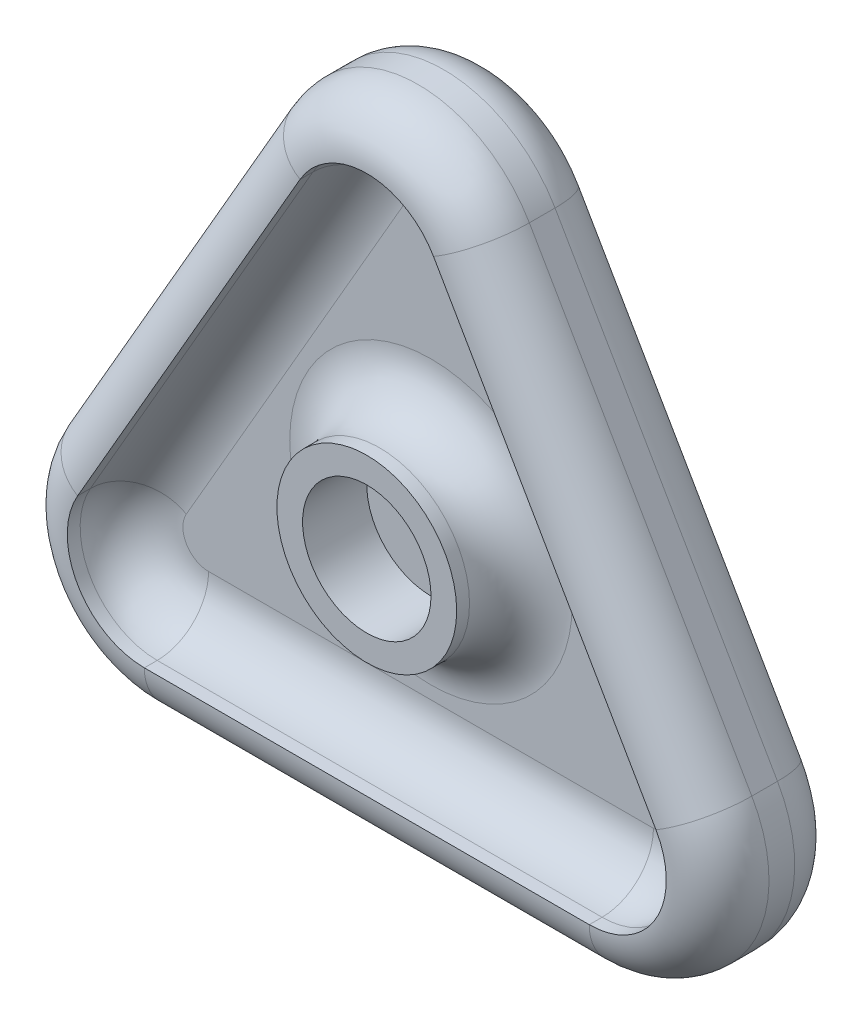
from build123d import *

# Parameters (mm, degrees)
EXTRUDE_1_DEPTH     = 5
CUT_EXTRUDE_1_DEPTH = 2.5
SKETCH_4_R          = 3.5
SKETCH_4_R_2        = 2.5
EXTRUDE_2_DEPTH     = 2.5
FILLET_1_R          = 2
FILLET_2_R          = 2
FILLET_3_R          = 2
SCALE_1_SCALE       = 2


with BuildPart() as part:
    # 草图2 → 凸台-拉伸1 (new body)
    with BuildSketch(Plane.XY):
        with BuildLine():
            Line((12.990381057, -2.5), (4.330127019, 12.5))
            ThreePointArc((4.330127019, 12.5), (0, 15), (-4.330127019, 12.5))
            Line((-4.330127019, 12.5), (-12.990381057, -2.5))
            ThreePointArc((-12.990381057, -2.5), (-12.990381057, -7.5), (-8.660254038, -10))
            Line((-8.660254038, -10), (8.660254038, -10))
            ThreePointArc((8.660254038, -10), (12.990381057, -7.5), (12.990381057, -2.5))
        make_face()
    extrude(amount=EXTRUDE_1_DEPTH)

    # 草图3 → 切除-拉伸1 (cut)
    with BuildSketch(Plane.XY.offset(5)):
        with BuildLine():
            Line((11.258330249, -3.5), (2.598076211, 11.5))
            ThreePointArc((2.598076211, 11.5), (0, 13), (-2.598076211, 11.5))
            Line((-2.598076211, 11.5), (-11.258330249, -3.5))
            ThreePointArc((-11.258330249, -3.5), (-11.258330249, -6.5), (-8.660254038, -8))
            Line((-8.660254038, -8), (8.660254038, -8))
            ThreePointArc((8.660254038, -8), (11.258330249, -6.5), (11.258330249, -3.5))
        make_face()
    extrude(amount=-CUT_EXTRUDE_1_DEPTH, mode=Mode.SUBTRACT)

    # 草图4 → 凸台-拉伸2 (add)
    with BuildSketch(Plane.XY.offset(2.5)):
        Circle(SKETCH_4_R)
        Circle(SKETCH_4_R_2, mode=Mode.SUBTRACT)
    extrude(amount=EXTRUDE_2_DEPTH)

    # 圆角1
    fillet_1_edges = [part.edges().sort_by_distance(p)[0] for p in [
        (0, 15, 5),
        (-8.660254038, 5, 5),
        (-12.990381057, -7.5, 5),
        (0, -10, 5),
        (12.990381057, -7.5, 5),
        (8.660254038, 5, 5),
    ]]
    fillet(fillet_1_edges, radius=FILLET_1_R - 0.0001)  # a hair under: the kernel refuses the full size

    # 圆角2
    fillet_2_edges = [part.edges().sort_by_distance(p)[0] for p in [
        (11.258330249, -6.5, 2.5),
        (0, -8, 2.5),
        (-11.258330249, -6.5, 2.5),
        (-6.92820323, 4, 2.5),
        (0, 13, 2.5),
        (6.92820323, 4, 2.5),
        (-3.5, 0, 2.5),
    ]]
    fillet(fillet_2_edges, radius=FILLET_2_R)

    # 圆角3
    fillet_3_edges = [part.edges().sort_by_distance(p)[0] for p in [
        (0, -10, 0),
        (-12.990381057, -7.5, 0),
        (-8.660254038, 5, 0),
        (0, 15, 0),
        (8.660254038, 5, 0),
        (12.990381057, -7.5, 0),
    ]]
    fillet(fillet_3_edges, radius=FILLET_3_R)


with BuildPart() as part_1:
    # 缩放比例1: scaled about (0, 0, 1.925767513)
    add(part.part.scale(SCALE_1_SCALE).moved(Location((0, 0, -1.925767513))))


solid = part_1.part
